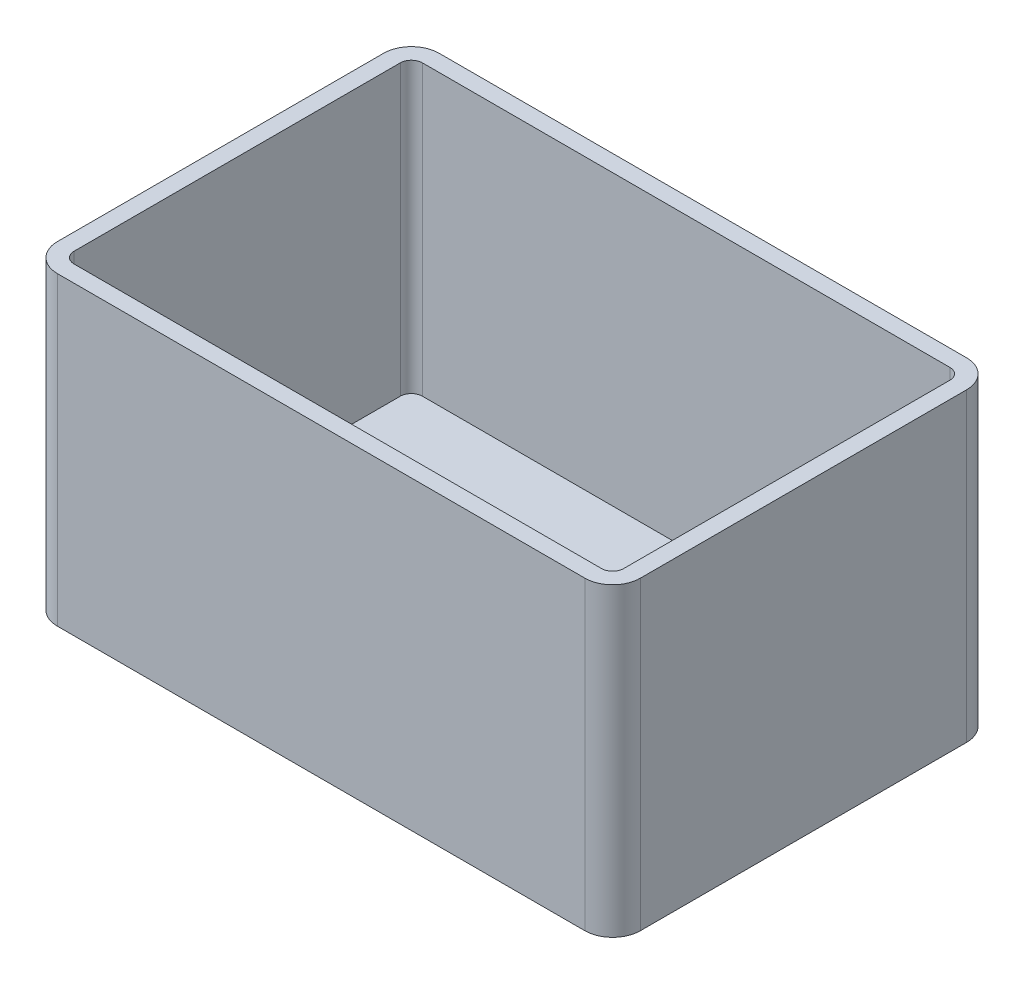
from build123d import *

# Parameters (mm, degrees)
BOSS_EXTRUDE1_DEPTH                     = 55
SHELL1_T                                = -3
CUT_EXTRUDE1_DEPTH                      = 2
BATTERY_CONNECTOR_SKETCH_3_R            = 2.15
CUT_EXTRUDE2_DEPTH                      = 3
BATTERY_CONNECTOR_SKETCH_4_R            = 2.15
CUT_EXTRUDE3_DEPTH                      = 3
BOSS_EXTRUDE6_START                     = 12.75
BOSS_EXTRUDE6_DEPTH                     = 12.75
CONNECTOR_MOUNT_PINS_SOCKETS_SKETCH_R   = 1.55
CONNECTOR_MOUNT_PINS_SOCKETS_SKETCH_R_2 = 1.505
CONNECTOR_MOUNT_PINS_SOCKETS_DEPTH      = 2.4


with BuildPart() as part:
    # Sketch2 → Boss-Extrude1 (new body)
    with BuildSketch(Plane(origin=(0, 0, 0), x_dir=(1, 0, 0), z_dir=(0, 1, 0))):
        with BuildLine():
            Line((47.5, -34.375), (-47.5, -34.375))
            ThreePointArc((-47.5, -34.375), (-51.035533906, -32.910533906), (-52.5, -29.375))
            Line((-52.5, -29.375), (-52.5, 29.375))
            ThreePointArc((-52.5, 29.375), (-51.035533906, 32.910533906), (-47.5, 34.375))
            Line((-47.5, 34.375), (47.5, 34.375))
            ThreePointArc((47.5, 34.375), (51.035533906, 32.910533906), (52.5, 29.375))
            Line((52.5, 29.375), (52.5, -29.375))
            ThreePointArc((52.5, -29.375), (51.035533906, -32.910533906), (47.5, -34.375))
        make_face()
    extrude(amount=BOSS_EXTRUDE1_DEPTH)

    # Shell1
    shell1_openings = [part.faces().sort_by_distance(p)[0] for p in [
        (0, 55, 0),
    ]]
    offset(amount=SHELL1_T, openings=shell1_openings, kind=Kind.INTERSECTION)

    # battery_connector_sketch → Cut-Extrude1 (cut)
    with BuildSketch(Plane(origin=(0, 3, 0), x_dir=(1, 0, 0), z_dir=(0, 1, 0))):
        with BuildLine():
            Line((-48.255414742, -4.831437415), (-48.255414742, -29.131437415))
            ThreePointArc((-48.255414742, -29.131437415), (-47.669628305, -30.545650977), (-46.255414742, -31.131437415))
            Line((-46.255414742, -31.131437415), (-40.255414742, -31.131437415))
            ThreePointArc((-40.255414742, -31.131437415), (-38.84120118, -30.545650977), (-38.255414742, -29.131437415))
            Line((-38.255414742, -29.131437415), (-38.255414742, -21.901437415))
            Line((-38.255414742, -21.901437415), (-39.505414742, -20.561437415))
            Line((-39.505414742, -20.561437415), (-39.505414742, -13.401437415))
            Line((-39.505414742, -13.401437415), (-38.255414742, -12.061437415))
            Line((-38.255414742, -12.061437415), (-38.255414742, -4.831437415))
            ThreePointArc((-38.255414742, -4.831437415), (-38.84120118, -3.417223852), (-40.255414742, -2.831437415))
            Line((-40.255414742, -2.831437415), (-46.255414742, -2.831437415))
            ThreePointArc((-46.255414742, -2.831437415), (-47.669628305, -3.417223852), (-48.255414742, -4.831437415))
        make_face()
    extrude(amount=-CUT_EXTRUDE1_DEPTH, mode=Mode.SUBTRACT)

    # battery_connector_sketch<3> → Cut-Extrude2 (cut)
    with BuildSketch(Plane(origin=(0, 3, 0), x_dir=(1, 0, 0), z_dir=(0, 1, 0))):
        with Locations((-43.255414742, -6.881437415)):
            Circle(BATTERY_CONNECTOR_SKETCH_3_R)
    extrude(amount=-CUT_EXTRUDE2_DEPTH, mode=Mode.SUBTRACT)

    # battery_connector_sketch<4> → Cut-Extrude3 (cut)
    with BuildSketch(Plane(origin=(0, 3, 0), x_dir=(1, 0, 0), z_dir=(0, 1, 0))):
        with Locations((-43.255414742, -24.831437415)):
            Circle(BATTERY_CONNECTOR_SKETCH_4_R)
    extrude(amount=-CUT_EXTRUDE3_DEPTH, mode=Mode.SUBTRACT)

    # Sketch25 → Boss-Extrude6 (add)
    with BuildSketch(Plane(origin=(0, 3, 0), x_dir=(1, 0, 0), z_dir=(0, 1, 0)).offset(BOSS_EXTRUDE6_START)):
        with BuildLine():
            Line((-46.255414742, -31.131437415), (-48.456518483, -31.131437415))
            ThreePointArc((-48.456518483, -31.131437415), (-49.21945296, -30.396509431), (-49.5, -29.375))
            Line((-49.5, -29.375), (-49.5, -2.831437415))
            Line((-49.5, -2.831437415), (-46.255414742, -2.831437415))
            ThreePointArc((-46.255414742, -2.831437415), (-47.669628305, -3.417223852), (-48.255414742, -4.831437415))
            Line((-48.255414742, -4.831437415), (-48.255414742, -29.131437415))
            ThreePointArc((-48.255414742, -29.131437415), (-47.669628305, -30.545650977), (-46.255414742, -31.131437415))
        make_face()
    extrude(amount=-BOSS_EXTRUDE6_DEPTH)

    # connector_mount_pins_sockets_sketch → connector_mount_pins_sockets (cut)
    with BuildSketch(Plane(origin=(-48.255414742, 0, 0), x_dir=(0, 0, -1), z_dir=(1, 0, 0))):
        with Locations((-9.891437415, 11.25)):
            Circle(CONNECTOR_MOUNT_PINS_SOCKETS_SKETCH_R)
        with Locations((-24.071437415, 11.25)):
            Circle(CONNECTOR_MOUNT_PINS_SOCKETS_SKETCH_R_2)
    extrude(amount=-CONNECTOR_MOUNT_PINS_SOCKETS_DEPTH, mode=Mode.SUBTRACT)


solid = part.part
